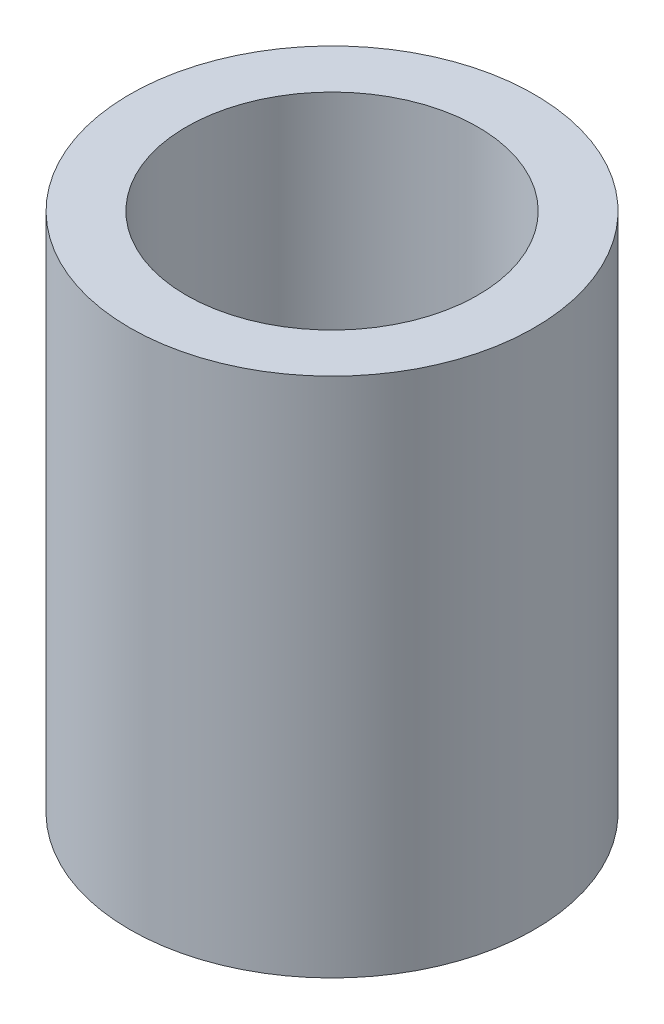
from build123d import *

# Parameters (mm, degrees)
SKETCH1_R           = 20
BOSS_EXTRUDE1_DEPTH = 51.539893053
SKETCH2_R           = 14.416431467
CUT_EXTRUDE1_DEPTH  = 59.790820507


with BuildPart() as part:
    # Sketch1 → Boss-Extrude1 (new body)
    with BuildSketch(Plane(origin=(0, 0, 0), x_dir=(1, 0, 0), z_dir=(0, 1, 0))):
        Circle(SKETCH1_R)
    extrude(amount=BOSS_EXTRUDE1_DEPTH)

    # Sketch2 → Cut-Extrude1 (cut, through all)
    with BuildSketch(Plane(origin=(0, 0, 0), x_dir=(1, 0, 0), z_dir=(0, 1, 0))):
        Circle(SKETCH2_R)
    extrude(amount=CUT_EXTRUDE1_DEPTH, mode=Mode.SUBTRACT)


solid = part.part
